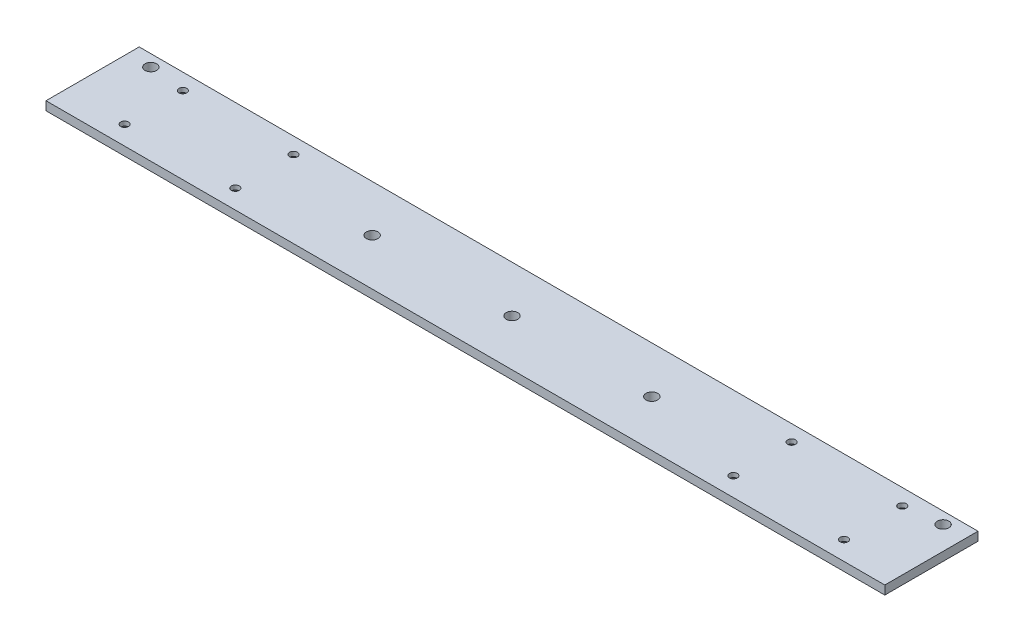
from build123d import *

# Parameters (mm, degrees)
SKETCH1_W                                     = 457.2
SKETCH1_H                                     = 50.8
BOSS_EXTRUDE1_DEPTH                           = 4.7625
SKETCH2_R                                     = 3.175
CUT_EXTRUDE1_DEPTH                            = 244.602
SKETCH3_R                                     = 3.175
CUT_EXTRUDE2_DEPTH                            = 244.602
CSK_FOR_8_FLAT_HEAD_MACHINE_SCREW1_AT_2_COUNT = 2
CSK_FOR_8_FLAT_HEAD_MACHINE_SCREW1_AT_2_PITCH = 31.75
CSK_FOR_8_FLAT_HEAD_MACHINE_SCREW1_AT_3_COUNT = 2
CSK_FOR_8_FLAT_HEAD_MACHINE_SCREW1_AT_3_PITCH = 68.170141008
CSK_FOR_8_FLAT_HEAD_MACHINE_SCREW1_AT_4_COUNT = 2
CSK_FOR_8_FLAT_HEAD_MACHINE_SCREW1_AT_4_PITCH = 60.325
CSK_FOR_8_FLAT_HEAD_MACHINE_SCREW1_AT_5_COUNT = 2
CSK_FOR_8_FLAT_HEAD_MACHINE_SCREW1_AT_5_PITCH = 331.8
CSK_FOR_8_FLAT_HEAD_MACHINE_SCREW1_AT_6_COUNT = 2
CSK_FOR_8_FLAT_HEAD_MACHINE_SCREW1_AT_6_PITCH = 333.315619946
CSK_FOR_8_FLAT_HEAD_MACHINE_SCREW1_AT_7_COUNT = 2
CSK_FOR_8_FLAT_HEAD_MACHINE_SCREW1_AT_7_PITCH = 393.408284261
CSK_FOR_8_FLAT_HEAD_MACHINE_SCREW1_AT_8_COUNT = 2
CSK_FOR_8_FLAT_HEAD_MACHINE_SCREW1_AT_8_PITCH = 392.125


with BuildPart() as part:
    # Sketch1 → Boss-Extrude1 (new body)
    with BuildSketch(Plane(origin=(0, 0, 0), x_dir=(1, 0, 0), z_dir=(0, 1, 0))):
        with Locations((228.6, 25.4)):
            Rectangle(SKETCH1_W, SKETCH1_H)
    extrude(amount=BOSS_EXTRUDE1_DEPTH)

    # Sketch2 → Cut-Extrude1 (cut)
    with BuildSketch(Plane(origin=(0, 4.7625, 0), x_dir=(1, 0, 0), z_dir=(0, 1, 0))):
        with Locations((12.7, 44.45)):
            Circle(SKETCH2_R)
        with Locations((444.5, 44.45)):
            Circle(SKETCH2_R)
    extrude(amount=-CUT_EXTRUDE1_DEPTH, mode=Mode.SUBTRACT)

    # Sketch3 → Cut-Extrude2 (cut)
    with BuildSketch(Plane(origin=(0, 4.7625, 0), x_dir=(1, 0, 0), z_dir=(0, 1, 0))):
        with Locations((152.4, 25.4)):
            Circle(SKETCH3_R)
        with Locations((304.8, 25.4)):
            Circle(SKETCH3_R)
        with Locations((228.6, 25.4)):
            Circle(SKETCH3_R)
    extrude(amount=-CUT_EXTRUDE2_DEPTH, mode=Mode.SUBTRACT)

    # Sketch7 → CSK for #8 Flat Head Machine Screw1 (revolve, cut)
    with BuildSketch(Plane(origin=(424.6625, 0, -42.06875), x_dir=(0, 0, -1), z_dir=(1, 0, 0))):
        Polygon((0, 0), (0, 4.7625), (2.15265, 4.7625), (2.15265, 2.3740728), (4.2164, 0), align=None)
    csk_for_8_flat_head_machine_screw1 = revolve(axis=Axis((424.6625, -6.35, -42.06875), (0, 1, 0)), mode=Mode.SUBTRACT)

    # CSK for #8 Flat Head Machine Screw1 at 2: CSK for #8 Flat Head Machine Screw1 ×2
    with Locations(*[(0, 0, i * CSK_FOR_8_FLAT_HEAD_MACHINE_SCREW1_AT_2_PITCH) for i in range(1, CSK_FOR_8_FLAT_HEAD_MACHINE_SCREW1_AT_2_COUNT)]):
        add(csk_for_8_flat_head_machine_screw1, mode=Mode.SUBTRACT)

    # CSK for #8 Flat Head Machine Screw1 at 3: CSK for #8 Flat Head Machine Screw1 ×2
    with Locations(*[Vector(-0.8849182223819825, 0, 0.46574643283262224) * (i * CSK_FOR_8_FLAT_HEAD_MACHINE_SCREW1_AT_3_PITCH) for i in range(1, CSK_FOR_8_FLAT_HEAD_MACHINE_SCREW1_AT_3_COUNT)]):
        add(csk_for_8_flat_head_machine_screw1, mode=Mode.SUBTRACT)

    # CSK for #8 Flat Head Machine Screw1 at 4: CSK for #8 Flat Head Machine Screw1 ×2
    with Locations(*[(-i * CSK_FOR_8_FLAT_HEAD_MACHINE_SCREW1_AT_4_PITCH, 0, 0) for i in range(1, CSK_FOR_8_FLAT_HEAD_MACHINE_SCREW1_AT_4_COUNT)]):
        add(csk_for_8_flat_head_machine_screw1, mode=Mode.SUBTRACT)

    # CSK for #8 Flat Head Machine Screw1 at 5: CSK for #8 Flat Head Machine Screw1 ×2
    with Locations(*[(-i * CSK_FOR_8_FLAT_HEAD_MACHINE_SCREW1_AT_5_PITCH, 0, 0) for i in range(1, CSK_FOR_8_FLAT_HEAD_MACHINE_SCREW1_AT_5_COUNT)]):
        add(csk_for_8_flat_head_machine_screw1, mode=Mode.SUBTRACT)

    # CSK for #8 Flat Head Machine Screw1 at 6: CSK for #8 Flat Head Machine Screw1 ×2
    with Locations(*[Vector(-0.9954528985282296, 0, 0.09525506186941606) * (i * CSK_FOR_8_FLAT_HEAD_MACHINE_SCREW1_AT_6_PITCH) for i in range(1, CSK_FOR_8_FLAT_HEAD_MACHINE_SCREW1_AT_6_COUNT)]):
        add(csk_for_8_flat_head_machine_screw1, mode=Mode.SUBTRACT)

    # CSK for #8 Flat Head Machine Screw1 at 7: CSK for #8 Flat Head Machine Screw1 ×2
    with Locations(*[Vector(-0.9967380344743431, 0, 0.0807049603941631) * (i * CSK_FOR_8_FLAT_HEAD_MACHINE_SCREW1_AT_7_PITCH) for i in range(1, CSK_FOR_8_FLAT_HEAD_MACHINE_SCREW1_AT_7_COUNT)]):
        add(csk_for_8_flat_head_machine_screw1, mode=Mode.SUBTRACT)

    # CSK for #8 Flat Head Machine Screw1 at 8: CSK for #8 Flat Head Machine Screw1 ×2
    with Locations(*[(-i * CSK_FOR_8_FLAT_HEAD_MACHINE_SCREW1_AT_8_PITCH, 0, 0) for i in range(1, CSK_FOR_8_FLAT_HEAD_MACHINE_SCREW1_AT_8_COUNT)]):
        add(csk_for_8_flat_head_machine_screw1, mode=Mode.SUBTRACT)


solid = part.part
